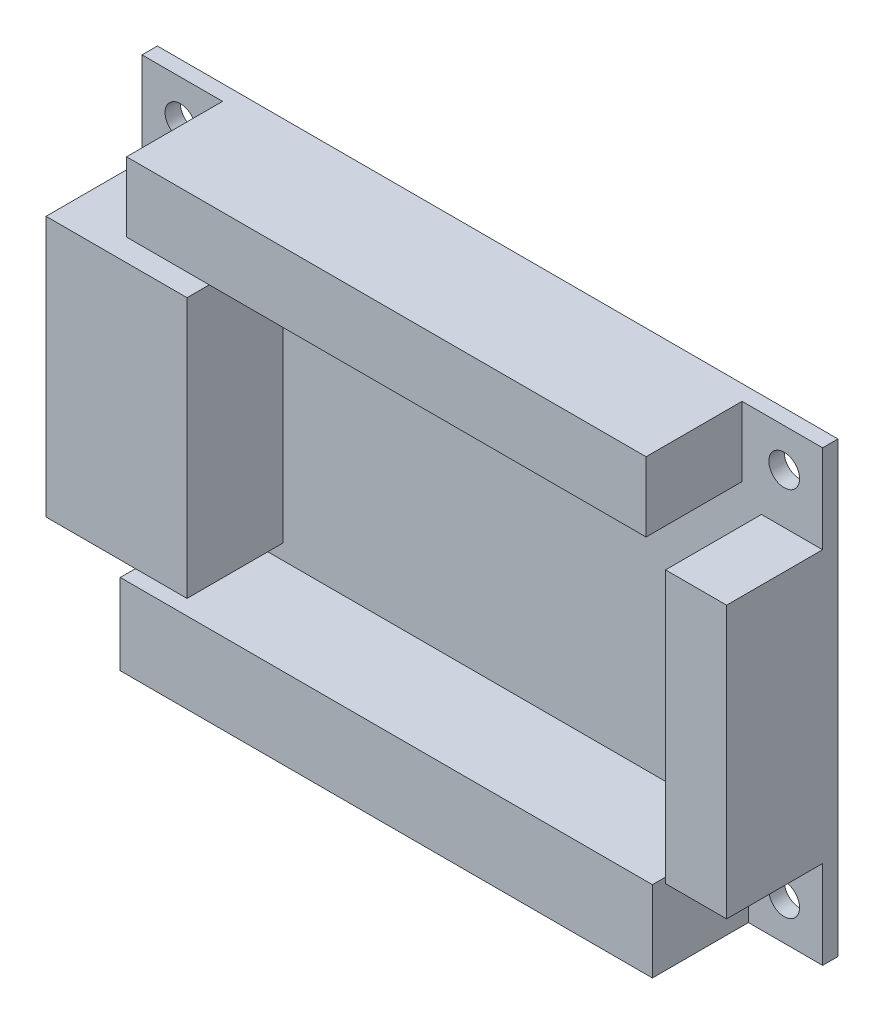
from build123d import *

# Parameters (mm, degrees)
ESBO_O1_W                = 70.9
ESBO_O1_H                = 46.7
ESBO_O1_R                = 1.6
RESSALTO_EXTRUS_O1_DEPTH = 1.6
ESBO_O2_W                = 55.440386952
ESBO_O2_H                = 8.419732819
ESBO_O2_W_2              = 54.120377738
ESBO_O2_H_2              = 7.246391297
ESBO_O2_W_3              = 6.366216247
ESBO_O2_H_3              = 28.306864236
ESBO_O2_W_4              = 14.686829994
ESBO_O2_H_4              = 27.133813881
RESSALTO_EXTRUS_O2_DEPTH = 10


with BuildPart() as part:
    # Esboço1 → Ressalto-extrusão1 (new body)
    with BuildSketch(Plane.XY):
        Rectangle(ESBO_O1_W, ESBO_O1_H)
        with Locations((-31.45, 19.35)):
            Circle(ESBO_O1_R, mode=Mode.SUBTRACT)
        with Locations((31.45, 19.35)):
            Circle(ESBO_O1_R, mode=Mode.SUBTRACT)
        with Locations((31.45, -19.35)):
            Circle(ESBO_O1_R, mode=Mode.SUBTRACT)
        with Locations((-31.45, -19.35)):
            Circle(ESBO_O1_R, mode=Mode.SUBTRACT)
    extrude(amount=RESSALTO_EXTRUS_O1_DEPTH)

    # Esboço2 → Ressalto-extrusão2 (add)
    with BuildSketch(Plane.XY.offset(1.6)):
        with Locations((0, -19.14013359)):
            Rectangle(ESBO_O2_W, ESBO_O2_H)
        with Locations((0, 19.726804352)):
            Rectangle(ESBO_O2_W_2, ESBO_O2_H_2)
        with Locations((32.266891877, 0)):
            Rectangle(ESBO_O2_W_3, ESBO_O2_H_3)
        with Locations((-28.106585003, 0.220147118)):
            Rectangle(ESBO_O2_W_4, ESBO_O2_H_4)
    extrude(amount=RESSALTO_EXTRUS_O2_DEPTH)


solid = part.part
